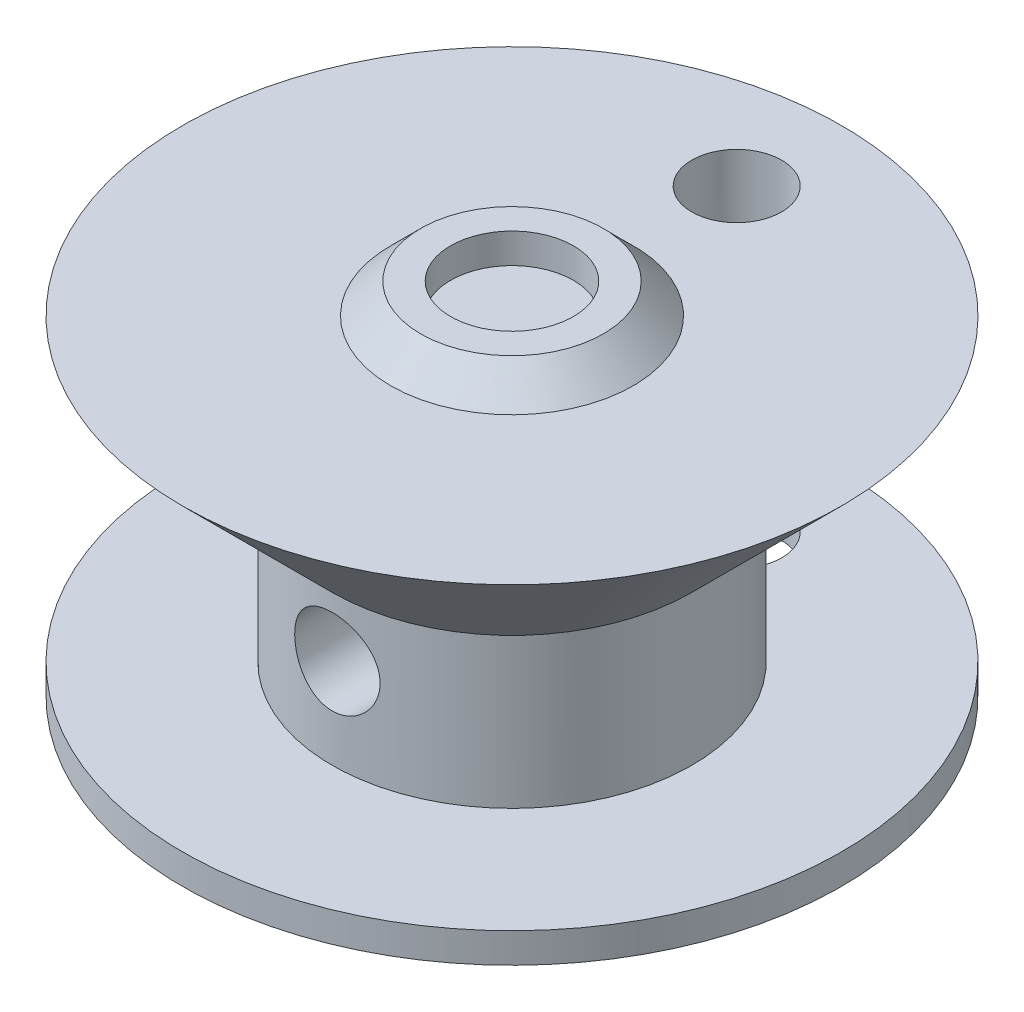
from build123d import *

# Parameters (mm, degrees)
FLAT_GROVE_EXTRUDE_REACH   = 21.647
WIRE_HOLE_CUT_DEPTH        = 20.052558883
WIRE_HOLE_CUT_DEPTH_BACK   = 20.052558883
SKETCH5_R                  = 1.5
SKETCH6_R                  = 1.425
SET_SCREW_CUT_DEPTH        = 18.698870187
MAGNET_START               = -1
SKETCH8_R                  = 11
SKETCH8_R_2                = 3.05
MAGNET_HOLDER_TRIM_DEPTH   = 1
MAGNET_HOLDER_CHAMFER_SIZE = 1
AXLE_TOLERANCE_CUT_DEPTH   = 8


with BuildPart() as part:
    # Sketch1 → Spool Solid (revolve)
    with BuildSketch(Plane(origin=(0, 0, 0), x_dir=(0, 0, -1), z_dir=(1, 0, 0)), mode=Mode.PRIVATE) as spool_solid_sk:
        Polygon((-2.05, 6), (-11, 6), (-11, 5), (-6, 0), (-6, -5), (-11, -5), (-11, -6), (-2, -6), (-2, 2), (0, 4), (0, 5), (-2.05, 5), align=None)
    revolve(spool_solid_sk.sketch.rotate(Axis((0, 0, 0), (0, 1, 0)), 180), axis=Axis((0, 0, 0), (0, 1, 0)))

    # Flat Grove Extrude: up to this cone (the profile starts inside it)
    flat_grove_extrude_end = Plane(origin=(0, -6, 0), z_dir=(0, -1, 0)).offset(-9.999999) * Cone(1e-06, 42.147, 42.146999, align=(Align.CENTER, Align.CENTER, Align.MIN), mode=Mode.PRIVATE)
    # Sketch2 → Flat Grove Extrude (add, up to the surface)
    with BuildSketch(Plane.XZ.offset(6), mode=Mode.PRIVATE) as flat_grove_extrude_sk1:
        with BuildLine():
            Line((1.322875656, 1.5), (-1.322875656, 1.5))
            ThreePointArc((-1.322875656, 1.5), (0, 2), (1.322875656, 1.5))
        make_face()
    flat_grove_extrude_tool1 = extrude(flat_grove_extrude_sk1.sketch, amount=-FLAT_GROVE_EXTRUDE_REACH, mode=Mode.PRIVATE) & flat_grove_extrude_end
    add(flat_grove_extrude_tool1.solids().sort_by_distance((0, -6, 1.702311))[0])

    # Sketch5 → Wire Hole Cut (cut, two sides: drawn at the far end of the back side and taken through both)
    with BuildSketch(Plane(origin=(0, -5, 0), x_dir=(1, 0, 0), z_dir=(0, 1, 0)).offset(-WIRE_HOLE_CUT_DEPTH_BACK)):
        with Locations(Location((0, 7.5, 0), (0, 0, 270))):
            Circle(SKETCH5_R)
    extrude(amount=WIRE_HOLE_CUT_DEPTH + WIRE_HOLE_CUT_DEPTH_BACK, mode=Mode.SUBTRACT)

    # Sketch6 → Set Screw Cut (cut, through all)
    with BuildSketch(Plane(origin=(0, 0, 1.5), x_dir=(-1, 0, 0), z_dir=(0, 0, -1))):
        with Locations((0, -2)):
            Circle(SKETCH6_R)
    extrude(amount=-SET_SCREW_CUT_DEPTH, mode=Mode.SUBTRACT)

    # Sketch8 → Magnet Holder Trim (cut)
    with BuildSketch(Plane(origin=(0, 6, 0), x_dir=(1, 0, 0), z_dir=(0, 1, 0)).offset(MAGNET_START)):
        with Locations(Location((0, 0, 0), (0, 0, 90))):
            Circle(SKETCH8_R)
        with Locations(Location((0, 0, 0), (0, 0, 270))):
            Circle(SKETCH8_R_2, mode=Mode.SUBTRACT)
    extrude(amount=MAGNET_HOLDER_TRIM_DEPTH, mode=Mode.SUBTRACT)

    # Magnet Holder Chamfer
    magnet_holder_chamfer_edges = [part.edges().sort_by_distance(p)[0] for p in [
        (0, 5, -3.05),
    ]]
    chamfer(magnet_holder_chamfer_edges, length=MAGNET_HOLDER_CHAMFER_SIZE - 0.0001)  # a hair under: the kernel refuses the full size

    # Sketch9 → Axle Tolerance Cut (cut)
    with BuildSketch(Plane.XZ.offset(6)):
        with BuildLine():
            Line((1.396424004, 1.7), (-1.396424004, 1.7))
            ThreePointArc((-1.396424004, 1.7), (0, -2.2), (1.396424004, 1.7))
        make_face()
    extrude(amount=-AXLE_TOLERANCE_CUT_DEPTH, mode=Mode.SUBTRACT)


solid = part.part
